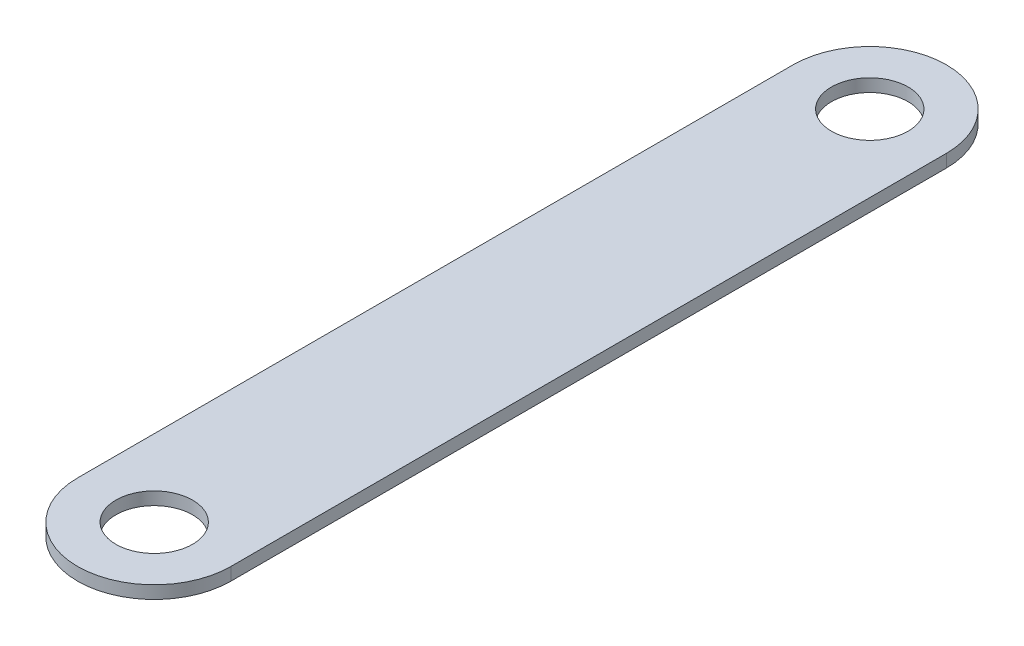
from build123d import *

# Parameters (mm, degrees)
SKETCH1_R           = 19.05
BOSS_EXTRUDE1_DEPTH = 6.35


with BuildPart() as part:
    # Sketch1 → Boss-Extrude1 (new body)
    with BuildSketch(Plane(origin=(0, 0, 0), x_dir=(1, 0, 0), z_dir=(0, 1, 0))):
        with BuildLine():
            Line((-38.1, 0), (-38.1, -355.6))
            ThreePointArc((-38.1, -355.6), (0, -393.7), (38.1, -355.6))
            Line((38.1, -355.6), (38.1, 0))
            ThreePointArc((38.1, 0), (0, 38.1), (-38.1, 0))
        make_face()
        Circle(SKETCH1_R, mode=Mode.SUBTRACT)
        with Locations((0, -355.6)):
            Circle(SKETCH1_R, mode=Mode.SUBTRACT)
    extrude(amount=BOSS_EXTRUDE1_DEPTH)


solid = part.part
